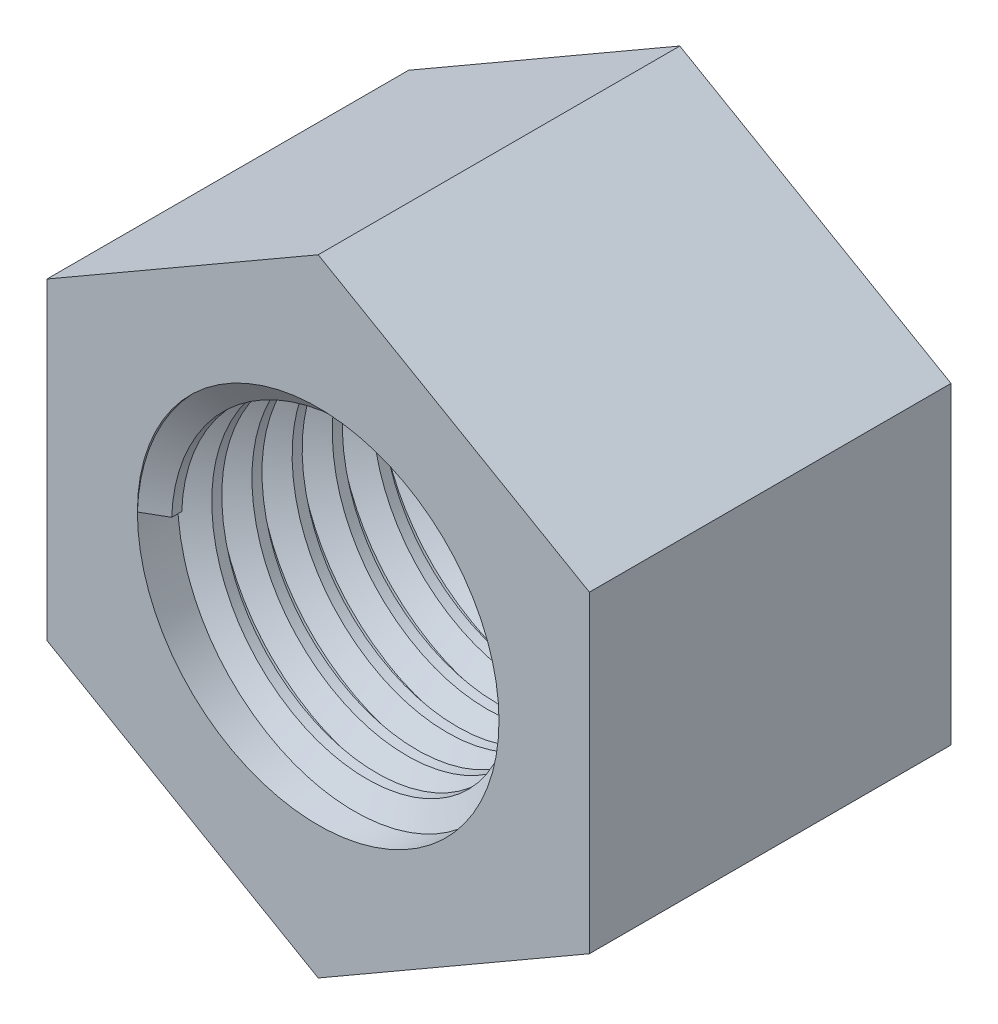
from build123d import *

# Parameters (mm, degrees)
SKETCH1_R           = 4.7625
BOSS_EXTRUDE1_DEPTH = 4.7625
THREAD1_PITCH       = 1.058333333


with BuildPart() as part:
    # Sketch1 → Boss-Extrude1 (new, symmetric)
    with BuildSketch(Plane.XY):
        Polygon((0, 8.248891971), (-7.14375, 4.124445986), (-7.14375, -4.124445986), (0, -8.248891971), (7.14375, -4.124445986), (7.14375, 4.124445986), align=None)
        with Locations(Location((0, 0, 0), (0, 0, 180))):
            Circle(SKETCH1_R, mode=Mode.SUBTRACT)
    extrude(amount=BOSS_EXTRUDE1_DEPTH, both=True)

    # Thread1: the profile of Thread Profile2 profile screwed along a right-hand helix of 9 turns, 8 arcs to a turn; built about Z, then put on its axis
    thread1_z = Axis((0, 0, 0), (0, 0, 1))
    thread1_corners = [(4.7628, 0, -0.000173205), (4.7628, 0, 0.926214869), (4.189660282, 0, 0.595312499), (4.189660282, 0, 0.330729165)]
    with BuildLine(mode=Mode.PRIVATE) as thread1_profile:
        Line(thread1_corners[0], thread1_corners[1])
        Line(thread1_corners[1], thread1_corners[2])
        Line(thread1_corners[2], thread1_corners[3])
        Line(thread1_corners[3], thread1_corners[0])
    thread1_cap = Face(thread1_profile.wire())
    thread1_turn_angles = [0, 22.5, 45, 67.5, 90, 112.5, 135, 157.5, 180, 202.5, 225, 247.5, 270, 292.5, 315, 337.5, 360]
    thread1_turn_weights = [1, 0.9238795325112867, 1, 0.9238795325112867, 1, 0.9238795325112867, 1, 0.9238795325112867, 1, 0.9238795325112867, 1, 0.9238795325112867, 1, 0.9238795325112867, 1, 0.9238795325112867, 1]
    thread1_turn_rails = [Edge.make_bspline([Vector(p[0], p[1], 0).rotate(thread1_z, thread1_turn_angles[k]) / thread1_turn_weights[k] + Vector(0, 0, p[2] + THREAD1_PITCH * thread1_turn_angles[k] / 360) for k in range(17)], [0, 0, 0, 1, 1, 2, 2, 3, 3, 4, 4, 5, 5, 6, 6, 7, 7, 8, 8, 8], 2, thread1_turn_weights) for p in thread1_corners]
    thread1_turn_sides = [Face.make_surface_from_curves(thread1_turn_rails[p[0]], thread1_turn_rails[p[1]]) for p in [(0, 1), (1, 2), (2, 3), (3, 0)]]
    thread1 = Plane(origin=(0, 0, 4.7625), x_dir=(-1, 0, 0), z_dir=(0, 0, -1)) * Solid(Shell([*[p.moved(Location((0, 0, THREAD1_PITCH * i))) for i in range(9) for p in thread1_turn_sides], thread1_cap, thread1_cap.rotate(thread1_z, 3240).moved(Location((0, 0, THREAD1_PITCH * 3240 / 360)))]))
    add(thread1)


solid = part.part
